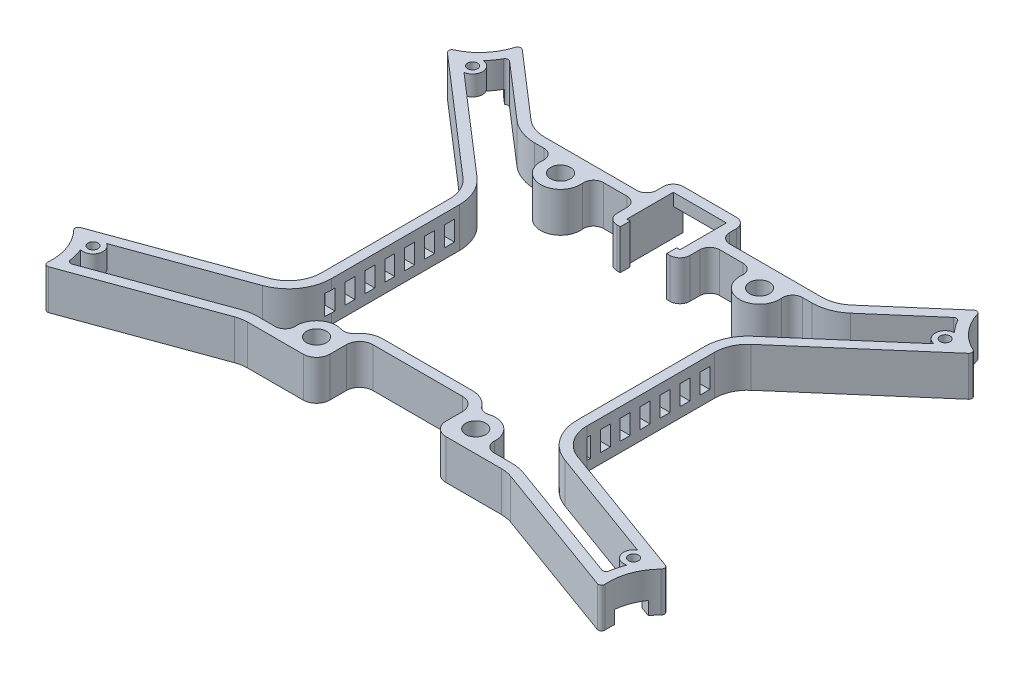
from build123d import *

# Parameters (mm, degrees)
BOSS_EXTRUDE1_DEPTH = 12
FILLET1_R           = 1
CUT_EXTRUDE1_DEPTH  = 4
SKETCH3_R           = 6
SKETCH3_R_2         = 3
BOSS_EXTRUDE2_DEPTH = 12
SKETCH4_W           = 16
SKETCH4_H           = 8.3
CUT_EXTRUDE2_DEPTH  = 114.389071885
BOSS_EXTRUDE3_DEPTH = 12
FILLET2_R           = 3
SKETCH6_W           = 3
SKETCH6_H           = 6
CUT_EXTRUDE3_DEPTH  = 147.997991498
SKETCH7_R           = 3
BOSS_EXTRUDE4_DEPTH = 6
SKETCH8_R           = 1.5
CUT_EXTRUDE4_DEPTH  = 3.2


with BuildPart() as part:
    # Sketch1 → Boss-Extrude1 (new body)
    with BuildSketch(Plane(origin=(0, 0, 0), x_dir=(1, 0, 0), z_dir=(0, 1, 0))):
        with BuildLine():
            Line((11, 53), (11, 55))
            ThreePointArc((11, 55), (10.121320344, 57.121320344), (8, 58))
            Line((8, 58), (-8, 58))
            ThreePointArc((-8, 58), (-10.121320344, 57.121320344), (-11, 55))
            Line((-11, 55), (-11, 53))
            ThreePointArc((-11, 53), (-11.878679656, 50.878679656), (-14, 50))
            Line((-14, 50), (-41.793261547, 50))
            ThreePointArc((-41.793261547, 50), (-45.286330682, 50.629916328), (-48.33933156, 52.440306397))
            Line((-48.33933156, 52.440306397), (-69.288125261, 70.580230773))
            ThreePointArc((-69.288125261, 70.580230773), (-72.904490235, 63.129264551), (-79.761837283, 58.484721008))
            Line((-79.761837283, 58.484721008), (-43.453929986, 27.045073359))
            ThreePointArc((-43.453929986, 27.045073359), (-40.904377423, 23.641056587), (-40, 19.485379755))
            Line((-40, 19.485379755), (-40, -19.043311809))
            ThreePointArc((-40, -19.043311809), (-41.808479557, -24.779076172), (-46.579798567, -28.440238017))
            Line((-46.579798567, -28.440238017), (-89.715398245, -44.140312337))
            ThreePointArc((-89.715398245, -44.140312337), (-84.964918067, -50.924701133), (-84.243075952, -59.175394269))
            Line((-84.243075952, -59.175394269), (-41.656931626, -43.675305343))
            ThreePointArc((-41.656931626, -43.675305343), (-39.97321197, -43.22415402), (-38.236730193, -43.07223155))
            Line((-38.236730193, -43.07223155), (-21.5, -43.07223155))
            ThreePointArc((-21.5, -43.07223155), (-18.671572875, -41.900658675), (-17.5, -39.07223155))
            Line((-17.5, -39.07223155), (-17.5, -34.07223155))
            ThreePointArc((-17.5, -34.07223155), (-16.328427125, -31.243804426), (-13.5, -30.07223155))
            Line((-13.5, -30.07223155), (13.5, -30.07223155))
            ThreePointArc((13.5, -30.07223155), (16.328427125, -31.243804426), (17.5, -34.07223155))
            Line((17.5, -34.07223155), (17.5, -39.07223155))
            ThreePointArc((17.5, -39.07223155), (18.671572875, -41.900658675), (21.5, -43.07223155))
            Line((21.5, -43.07223155), (38.236730193, -43.07223155))
            ThreePointArc((38.236730193, -43.07223155), (39.97321197, -43.22415402), (41.656931626, -43.675305343))
            Line((41.656931626, -43.675305343), (84.243075952, -59.175394269))
            ThreePointArc((84.243075952, -59.175394269), (84.964918067, -50.924701133), (89.715398245, -44.140312337))
            Line((89.715398245, -44.140312337), (46.579798567, -28.440238017))
            ThreePointArc((46.579798567, -28.440238017), (41.808479557, -24.779076172), (40, -19.043311809))
            Line((40, -19.043311809), (40, 19.485379755))
            ThreePointArc((40, 19.485379755), (40.904377423, 23.641056587), (43.453929986, 27.045073359))
            Line((43.453929986, 27.045073359), (79.761837283, 58.484721008))
            ThreePointArc((79.761837283, 58.484721008), (72.904490235, 63.129264551), (69.288125261, 70.580230773))
            Line((69.288125261, 70.580230773), (48.33933156, 52.440306397))
            ThreePointArc((48.33933156, 52.440306397), (45.286330682, 50.629916328), (41.793261547, 50))
            Line((41.793261547, 50), (14, 50))
            ThreePointArc((14, 50), (11.878679656, 50.878679656), (11, 53))
        make_face()
        with BuildLine():
            Line((8, 53), (8, 55))
            Line((8, 55), (-8, 55))
            Line((-8, 55), (-8, 53))
            ThreePointArc((-8, 53), (-9.757359313, 48.757359313), (-14, 47))
            Line((-14, 47), (-41.793261547, 47))
            ThreePointArc((-41.793261547, 47), (-46.334251422, 47.818891227), (-50.303152565, 50.172398316))
            Line((-50.303152565, 50.172398316), (-67.869817726, 65.383678838))
            ThreePointArc((-67.869817726, 65.383678838), (-70.636582154, 61.165443547), (-74.41588774, 57.823985235))
            Line((-74.41588774, 57.823985235), (-41.490108982, 29.312981439))
            ThreePointArc((-41.490108982, 29.312981439), (-38.175690649, 24.887759637), (-37, 19.485379755))
            Line((-37, 19.485379755), (-37, -19.043311809))
            ThreePointArc((-37, -19.043311809), (-39.351023424, -26.499805481), (-45.553738137, -31.259315879))
            Line((-45.553738137, -31.259315879), (-84.485250458, -45.429227539))
            ThreePointArc((-84.485250458, -45.429227539), (-82.145840205, -49.898640703), (-81.065049024, -54.826153747))
            Line((-81.065049024, -54.826153747), (-42.682992056, -40.85622748))
            ThreePointArc((-42.682992056, -40.85622748), (-40.494156503, -40.269730761), (-38.236730193, -40.07223155))
            Line((-38.236730193, -40.07223155), (-21.5, -40.07223155))
            ThreePointArc((-21.5, -40.07223155), (-20.792893219, -39.779338332), (-20.5, -39.07223155))
            Line((-20.5, -39.07223155), (-20.5, -34.07223155))
            ThreePointArc((-20.5, -34.07223155), (-18.449747468, -29.122484082), (-13.5, -27.07223155))
            Line((-13.5, -27.07223155), (13.5, -27.07223155))
            ThreePointArc((13.5, -27.07223155), (18.449747468, -29.122484082), (20.5, -34.07223155))
            Line((20.5, -34.07223155), (20.5, -39.07223155))
            ThreePointArc((20.5, -39.07223155), (20.792893219, -39.779338332), (21.5, -40.07223155))
            Line((21.5, -40.07223155), (38.236730193, -40.07223155))
            ThreePointArc((38.236730193, -40.07223155), (40.494156503, -40.269730761), (42.682992056, -40.85622748))
            Line((42.682992056, -40.85622748), (81.065049024, -54.826153747))
            ThreePointArc((81.065049024, -54.826153747), (82.145840205, -49.898640703), (84.485250458, -45.429227539))
            Line((84.485250458, -45.429227539), (45.553738137, -31.259315879))
            ThreePointArc((45.553738137, -31.259315879), (39.351023424, -26.499805481), (37, -19.043311809))
            Line((37, -19.043311809), (37, 19.485379755))
            ThreePointArc((37, 19.485379755), (38.175690649, 24.887759637), (41.490108982, 29.312981439))
            Line((41.490108982, 29.312981439), (74.41588774, 57.823985235))
            ThreePointArc((74.41588774, 57.823985235), (70.636582154, 61.165443547), (67.869817726, 65.383678838))
            Line((67.869817726, 65.383678838), (50.303152565, 50.172398316))
            ThreePointArc((50.303152565, 50.172398316), (46.334251422, 47.818891227), (41.793261547, 47))
            Line((41.793261547, 47), (14, 47))
            ThreePointArc((14, 47), (9.757359313, 48.757359313), (8, 53))
        make_face(mode=Mode.SUBTRACT)
    extrude(amount=BOSS_EXTRUDE1_DEPTH)

    # Fillet1
    fillet1_edges = [part.edges().sort_by_distance(p)[0] for p in [
        (-67.869817726, 6, -65.383678838),
        (-74.41588774, 6, -57.823985235),
        (-84.485250458, 6, 45.429227539),
        (-81.065049024, 6, 54.826153747),
        (81.065049024, 6, 54.826153747),
        (84.485250458, 6, 45.429227539),
        (74.41588774, 6, -57.823985235),
        (67.869817726, 6, -65.383678838),
        (69.288125261, 6, -70.580230773),
        (79.761837283, 6, -58.484721008),
        (89.715398245, 6, 44.140312337),
        (84.243075952, 6, 59.175394269),
        (-84.243075952, 6, 59.175394269),
        (-89.715398245, 6, 44.140312337),
        (-79.761837283, 6, -58.484721008),
        (-69.288125261, 6, -70.580230773),
    ]]
    fillet(fillet1_edges, radius=FILLET1_R)

    # Sketch2 → Cut-Extrude1 (cut)
    with BuildSketch(Plane.XZ):
        Polygon((-87.902718401, 56.250684099), (-69.108865986, 49.410281233), (-71.845027132, 41.892740266), (-90.638879548, 48.733143133), align=None)
        Polygon((-63.095976831, -49.344682669), (-78.215364037, -62.436822697), (-72.978508026, -68.48457758), (-57.85912082, -55.392437552), align=None)
        Polygon((57.85912082, -55.392437552), (63.095976831, -49.344682669), (78.215364037, -62.436822697), (72.978508026, -68.48457758), align=None)
        Polygon((90.638879548, 48.733143133), (87.902718401, 56.250684099), (69.108865986, 49.410281233), (71.845027132, 41.892740266), align=None)
    extrude(amount=-CUT_EXTRUDE1_DEPTH, mode=Mode.SUBTRACT)

    # Sketch3 → Boss-Extrude2 (add)
    # profile 1 of 4: a face of its own
    with BuildSketch(Plane(origin=(0, 12, 0), x_dir=(1, 0, 0), z_dir=(0, 1, 0))):
        with Locations((-30, 43)):
            Circle(SKETCH3_R)
        with Locations(Location((-30, 43, 0), (0, 0, 270))):
            Circle(SKETCH3_R_2, mode=Mode.SUBTRACT)
    # profile 2 of 4: a face of its own
    with BuildSketch(Plane(origin=(0, 12, 0), x_dir=(1, 0, 0), z_dir=(0, 1, 0))):
        with Locations((30, 43)):
            Circle(SKETCH3_R)
        with Locations(Location((30, 43, 0), (0, 0, 270))):
            Circle(SKETCH3_R_2, mode=Mode.SUBTRACT)
    # profile 3 of 4: a face of its own
    with BuildSketch(Plane(origin=(0, 12, 0), x_dir=(1, 0, 0), z_dir=(0, 1, 0))):
        with Locations((-24, -36.57223155)):
            Circle(SKETCH3_R)
        with Locations(Location((-24, -36.57223155, 0), (0, 0, 270))):
            Circle(SKETCH3_R_2, mode=Mode.SUBTRACT)
    # profile 4 of 4: a face of its own
    with BuildSketch(Plane(origin=(0, 12, 0), x_dir=(1, 0, 0), z_dir=(0, 1, 0))):
        with Locations((24, -36.57223155)):
            Circle(SKETCH3_R)
        with Locations(Location((24, -36.57223155, 0), (0, 0, 270))):
            Circle(SKETCH3_R_2, mode=Mode.SUBTRACT)
    extrude(amount=-BOSS_EXTRUDE2_DEPTH)

    # Sketch4 → Cut-Extrude2 (cut, through all)
    with BuildSketch(Plane(origin=(0, 2.020470847, 0), x_dir=(-1, 0, 0), z_dir=(0, 0, -1))):
        with Locations((0, 2.129529153)):
            Rectangle(SKETCH4_W, SKETCH4_H)
    extrude(amount=CUT_EXTRUDE2_DEPTH, mode=Mode.SUBTRACT)

    # Sketch5 → Boss-Extrude3 (add)
    with BuildSketch(Plane.XZ):
        Polygon((-8, -55), (-8, -41), (-7, -41), (-7, -38), (-11, -38), (-11, -55), align=None)
        Polygon((7, -41), (8, -41), (8, -55), (11, -55), (11, -38), (7, -38), align=None)
    extrude(amount=-BOSS_EXTRUDE3_DEPTH)

    # Fillet2
    fillet2_edges = [part.edges().sort_by_distance(p)[0] for p in [
        (-20.171352834, 6, 31.952549648),
        (-28.873397172, 6, 40.07223155),
        (20.171352834, 6, 31.952549648),
        (28.873397172, 6, 40.07223155),
        (34.472135955, 6, -47),
        (25.527864045, 6, -47),
        (-25.527864045, 6, -47),
        (-34.472135955, 6, -47),
        (-11, 6, -38),
        (11, 6, -38),
        (11, 6, -47.803847577),
        (-11, 6, -47.803847577),
    ]]
    fillet(fillet2_edges, radius=FILLET2_R - 0.0001)  # a hair under: the kernel refuses the full size

    # Sketch6 → Cut-Extrude3 (cut, through all)
    with BuildSketch(Plane(origin=(40, 0, 0), x_dir=(0, 0, -1), z_dir=(1, 0, 0))):
        with Locations((-19.5, 6)):
            Rectangle(SKETCH6_W, SKETCH6_H)
        with Locations((-13.5, 6)):
            Rectangle(SKETCH6_W, SKETCH6_H)
        with Locations((-7.5, 6)):
            Rectangle(SKETCH6_W, SKETCH6_H)
        with Locations((-1.5, 6)):
            Rectangle(SKETCH6_W, SKETCH6_H)
        with Locations((4.5, 6)):
            Rectangle(SKETCH6_W, SKETCH6_H)
        with Locations((10.5, 6)):
            Rectangle(SKETCH6_W, SKETCH6_H)
        with Locations((16.5, 6)):
            Rectangle(SKETCH6_W, SKETCH6_H)
    extrude(amount=-CUT_EXTRUDE3_DEPTH, mode=Mode.SUBTRACT)

    # Sketch7 → Boss-Extrude4 (add)
    with BuildSketch(Plane(origin=(0, 12, 0), x_dir=(1, 0, 0), z_dir=(0, 1, 0))):
        with Locations((-81.494916078, -46.469190379)):
            Circle(SKETCH7_R)
        with Locations((-71.251292912, 57.729317468)):
            Circle(SKETCH7_R)
        with Locations((71.251292912, 57.729317468)):
            Circle(SKETCH7_R)
        with Locations((81.494916078, -46.469190379)):
            Circle(SKETCH7_R)
    extrude(amount=-BOSS_EXTRUDE4_DEPTH)

    # Sketch8 → Cut-Extrude4 (cut)
    with BuildSketch(Plane(origin=(0, 12, 0), x_dir=(1, 0, 0), z_dir=(0, 1, 0))):
        with Locations(Location((-71.251292912, 57.729317468, 0), (0, 0, 270))):
            Circle(SKETCH8_R)
        with Locations(Location((-81.494916078, -46.469190379, 0), (0, 0, 270))):
            Circle(SKETCH8_R)
        with Locations(Location((81.494916078, -46.469190379, 0), (0, 0, 270))):
            Circle(SKETCH8_R)
        with Locations(Location((71.251292912, 57.729317468, 0), (0, 0, 270))):
            Circle(SKETCH8_R)
    extrude(amount=-CUT_EXTRUDE4_DEPTH, mode=Mode.SUBTRACT)


solid = part.part
